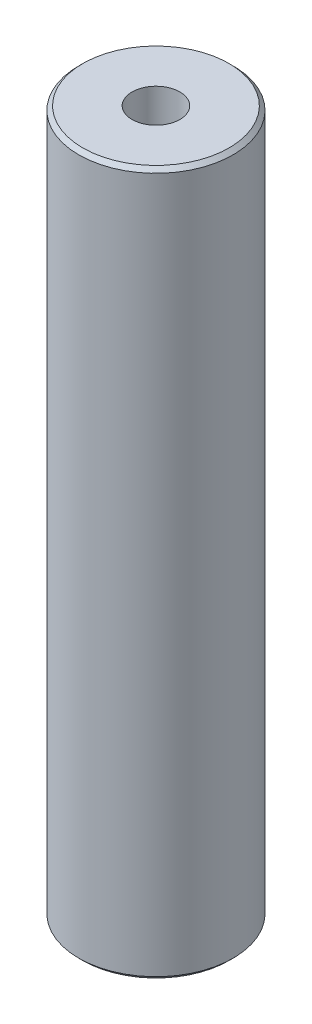
from build123d import *

# Parameters (mm, degrees)
SKETCH1_R           = 60
BOSS_EXTRUDE1_DEPTH = 547.333783929
SKETCH2_R           = 18.59516652
CUT_EXTRUDE1_DEPTH  = 554.872070996
CHAMFER1_SIZE       = 3.113792367


with BuildPart() as part:
    # Sketch1 → Boss-Extrude1 (new body)
    with BuildSketch(Plane(origin=(0, 0, 0), x_dir=(1, 0, 0), z_dir=(0, 1, 0))):
        Circle(SKETCH1_R)
    extrude(amount=BOSS_EXTRUDE1_DEPTH)

    # Sketch2 → Cut-Extrude1 (cut, through all)
    with BuildSketch(Plane(origin=(0, 0, 0), x_dir=(1, 0, 0), z_dir=(0, 1, 0))):
        Circle(SKETCH2_R)
    extrude(amount=CUT_EXTRUDE1_DEPTH, mode=Mode.SUBTRACT)

    # Chamfer1
    chamfer1_edges = [part.edges().sort_by_distance(p)[0] for p in [
        (-60, 547.333783929, 0),
        (-60, 0, 0),
    ]]
    chamfer(chamfer1_edges, length=CHAMFER1_SIZE)


solid = part.part
